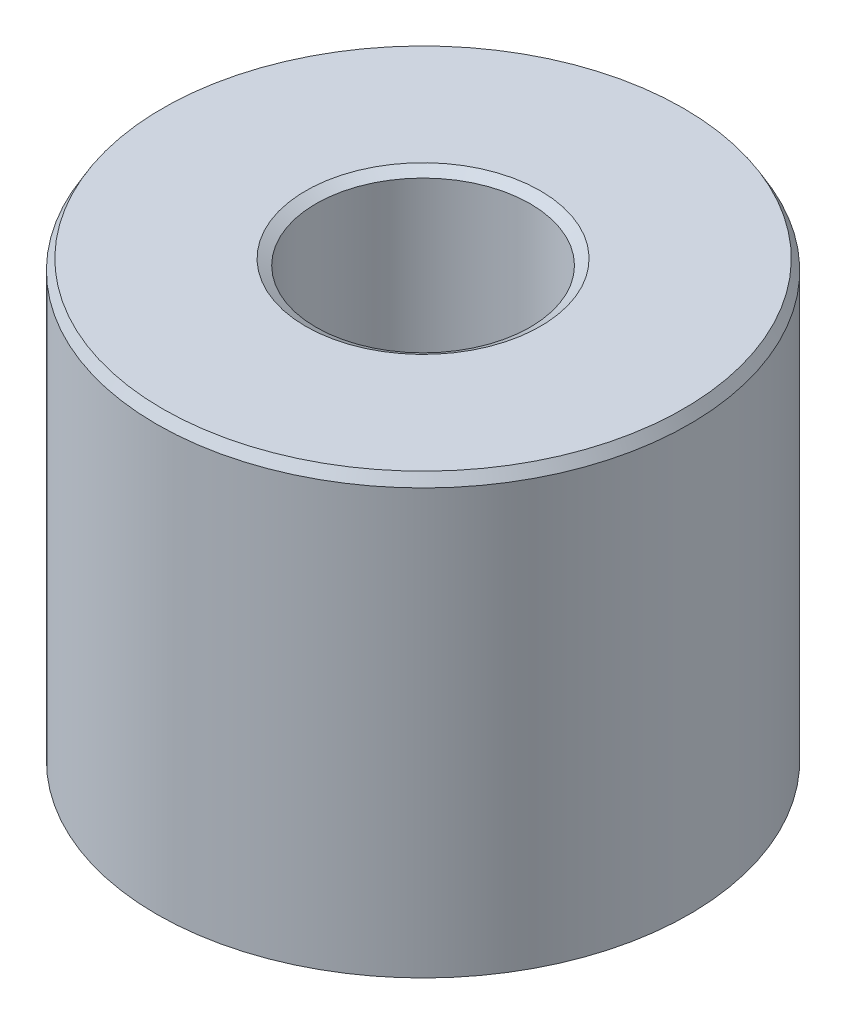
from build123d import *
from OCP.BRepFilletAPI import BRepFilletAPI_MakeChamfer

# Parameters (mm, degrees)
SKETCH1_R           = 25
BOSS_EXTRUDE1_DEPTH = 41.3612513
SKETCH2_R           = 10.049549906
CUT_EXTRUDE1_DEPTH  = 55.412802805
CHAMFER1_SIZE       = 0.970132481
CHAMFER1_SIZE2      = 0.560106249


with BuildPart() as part:
    # Sketch1 → Boss-Extrude1 (new body)
    with BuildSketch(Plane(origin=(0, 0, 0), x_dir=(1, 0, 0), z_dir=(0, 1, 0))):
        Circle(SKETCH1_R)
    extrude(amount=BOSS_EXTRUDE1_DEPTH)

    # Sketch2 → Cut-Extrude1 (cut, through all)
    with BuildSketch(Plane(origin=(0, 0, 0), x_dir=(1, 0, 0), z_dir=(0, 1, 0))):
        Circle(SKETCH2_R)
    extrude(amount=CUT_EXTRUDE1_DEPTH, mode=Mode.SUBTRACT)

    # Chamfer1: one chamfer whose edges measure the first distance from different faces: ONE call of the kernel's chamfer builder (chamfer() names one face for all edges)
    chamfer1_edges_1 = [part.edges().sort_by_distance(p)[0] for p in [
        (-10.049549906, 41.3612513, 0),
    ]]
    chamfer1_side_1 = [part.faces().sort_by_distance(p)[0] for p in [
        (-24.292893219, 41.3612513, 0),
    ]]
    chamfer1_edges_2 = [part.edges().sort_by_distance(p)[0] for p in [
        (-10.049549906, 0, 0),
    ]]
    chamfer1_side_2 = [part.faces().sort_by_distance(p)[0] for p in [
        (-10.049549906, 20.68062565, 0),
    ]]
    chamfer1_edges_3 = [part.edges().sort_by_distance(p)[0] for p in [
        (-25, 0, 0),
    ]]
    chamfer1_side_3 = [part.faces().sort_by_distance(p)[0] for p in [
        (-24.292893219, 0, 0),
    ]]
    chamfer1_edges_4 = [part.edges().sort_by_distance(p)[0] for p in [
        (-25, 41.3612513, 0),
    ]]
    chamfer1_side_4 = [part.faces().sort_by_distance(p)[0] for p in [
        (-25, 20.68062565, 0),
    ]]
    chamfer1 = BRepFilletAPI_MakeChamfer(part.part.solid().wrapped)
    for e in chamfer1_edges_1:
        chamfer1.Add(CHAMFER1_SIZE, CHAMFER1_SIZE2, e.wrapped, chamfer1_side_1[0].wrapped)  # the first distance lies on this face
    for e in chamfer1_edges_2:
        chamfer1.Add(CHAMFER1_SIZE, CHAMFER1_SIZE2, e.wrapped, chamfer1_side_2[0].wrapped)  # the first distance lies on this face
    for e in chamfer1_edges_3:
        chamfer1.Add(CHAMFER1_SIZE, CHAMFER1_SIZE2, e.wrapped, chamfer1_side_3[0].wrapped)  # the first distance lies on this face
    for e in chamfer1_edges_4:
        chamfer1.Add(CHAMFER1_SIZE, CHAMFER1_SIZE2, e.wrapped, chamfer1_side_4[0].wrapped)  # the first distance lies on this face
    add(Compound.cast(chamfer1.Shape()), mode=Mode.REPLACE)


solid = part.part
